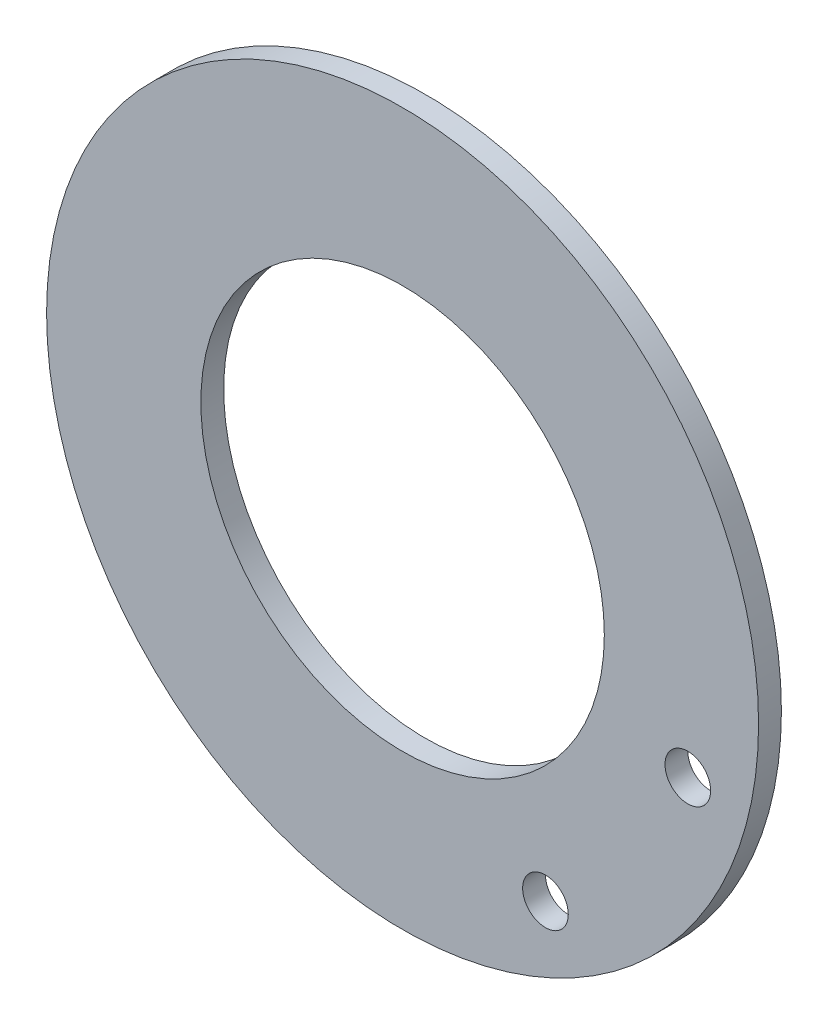
from build123d import *

# Parameters (mm, degrees)
SKETCH1_R           = 49.53
SKETCH1_R_2         = 28.067
BOSS_EXTRUDE1_DEPTH = 3.175
SKETCH2_R           = 3.175
CUT_EXTRUDE1_DEPTH  = 22.86


with BuildPart() as part:
    # Sketch1 → Boss-Extrude1 (new body)
    with BuildSketch(Plane.XY):
        Circle(SKETCH1_R)
        Circle(SKETCH1_R_2, mode=Mode.SUBTRACT)
    extrude(amount=BOSS_EXTRUDE1_DEPTH)

    # Sketch2 → Cut-Extrude1 (cut)
    with BuildSketch(Plane(origin=(182.011125234, -492.106103264, 3.175), x_dir=(0.6237862645633958, 0.7815949693684352, 0), z_dir=(0, 0, 1))):
        with Locations((255.216614788, 411.128007776)):
            Circle(SKETCH2_R)
        with Locations((286.966614788, 411.128007776)):
            Circle(SKETCH2_R)
    extrude(amount=-CUT_EXTRUDE1_DEPTH, mode=Mode.SUBTRACT)


solid = part.part
